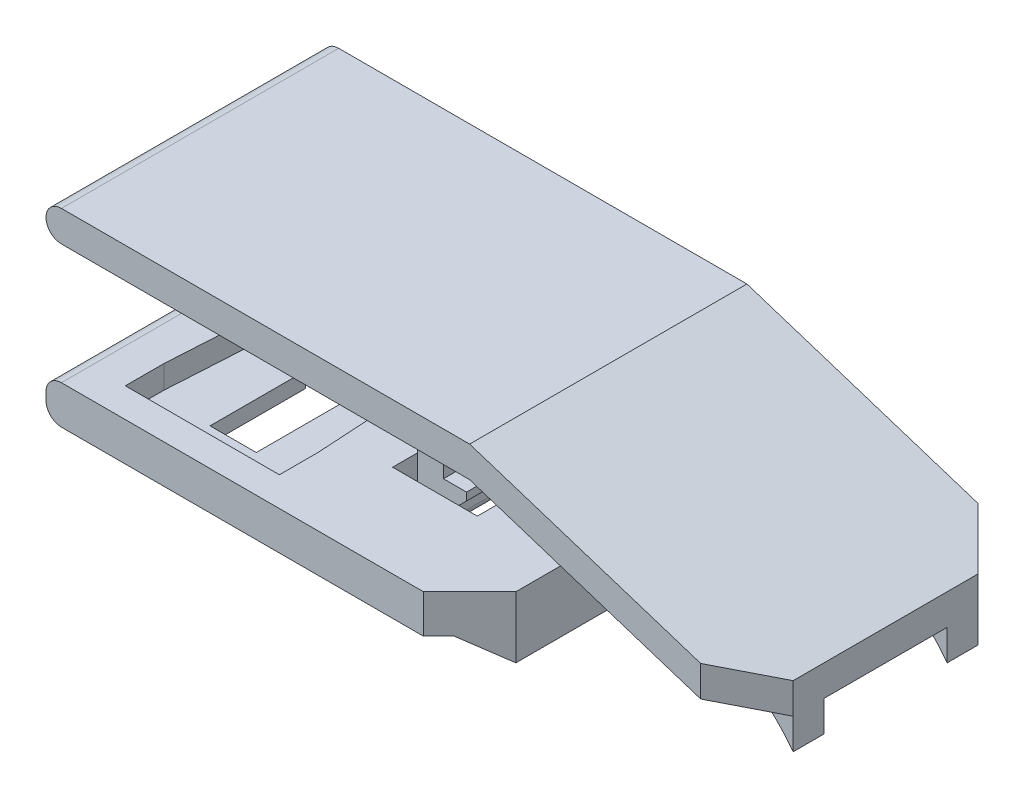
from build123d import *

# Parameters (mm, degrees)
BOSS_EXTRUDE1_DEPTH     = 18
BOSS_EXTRUDE1_2_DEPTH   = 18
SKETCH2_W               = 5.5
SKETCH2_H               = 6
CUT_EXTRUDE1_DEPTH      = 3
BOSS_EXTRUDE2_DEPTH     = 6
BOSS_EXTRUDE3_START     = -9
BOSS_EXTRUDE3_DEPTH     = 2.5
FILLET7_R               = 1
FILLET8_R               = 1
FILLET10_R              = 1
FILLET11_R              = 1
BOSS_EXTRUDE4_START     = -3
BOSS_EXTRUDE4_DEPTH     = 2
BOSS_EXTRUDE5_START     = -13
BOSS_EXTRUDE5_DEPTH     = 2
FILLET12_R              = 0.5
FILLET13_R              = 0.5
CUT_EXTRUDE2_DEPTH      = 1.5
CUT_EXTRUDE2_DEPTH_BACK = 9
CUT_EXTRUDE3_DEPTH      = 51.839846577
CUT_EXTRUDE9_DEPTH      = 51.453344785
CUT_EXTRUDE9_DEPTH_BACK = 2.5
CUT_EXTRUDE10_DEPTH     = 1
BOSS_EXTRUDE8_START     = 7
BOSS_EXTRUDE8_DEPTH     = 4


with BuildPart() as part:
    # Sketch1 → Boss-Extrude1 (new body)
    with BuildSketch(Plane.XY):
        Polygon((0, 4), (-18, 9.8), (-45.5, 9.8), (-45.5, 7.8), (-18, 7.8), (0, 2), align=None)
    extrude(amount=BOSS_EXTRUDE1_DEPTH)

    # Sketch4 → Boss-Extrude3 (add, symmetric)
    with BuildSketch(Plane.XY.offset(18).offset(BOSS_EXTRUDE3_START)):
        with BuildLine():
            Line((-26.7, -2), (-24.7, 0))
            Line((-24.7, 0), (-24.7, 0.5))
            Line((-24.7, 0.5), (-26.2, 0.5))
            Line((-26.2, 0.5), (-26.2, 1.5))
            Line((-26.2, 1.5), (-19.9, 7.8))
            Line((-19.9, 7.8), (-22.304163056, 7.8))
            Line((-22.304163056, 7.8), (-27.402081528, 2.702081528))
            ThreePointArc((-27.402081528, 2.702081528), (-27.770595205, 2.150561835), (-27.9, 1.5))
            Line((-27.9, 1.5), (-27.9, -3))
            Line((-27.9, -3), (-26.7, -3))
            Line((-26.7, -3), (-26.7, -2))
        make_face()
    extrude(amount=BOSS_EXTRUDE3_DEPTH, both=True)

    # Fillet8
    fillet8_edges = [part.edges().sort_by_distance(p)[0] for p in [
        (-45.5, 7.8, 9),
    ]]
    fillet(fillet8_edges, radius=FILLET8_R)

    # Fillet10
    fillet10_edges = [part.edges().sort_by_distance(p)[0] for p in [
        (-45.5, 9.8, 9),
    ]]
    fillet(fillet10_edges, radius=FILLET10_R - 0.0001)  # a hair under: the kernel refuses the full size

    # Sketch5 → Boss-Extrude4 (add)
    with BuildSketch(Plane.XY.offset(18).offset(BOSS_EXTRUDE4_START)):
        with BuildLine():
            Line((0, 2), (0, 0))
            ThreePointArc((0, 0), (-2.215757041, 2.201466243), (-5.002612018, 3.611952761))
            Line((-5.002612018, 3.611952761), (0, 2))
        make_face()
    extrude(amount=-BOSS_EXTRUDE4_DEPTH)

    # Sketch5<2> → Boss-Extrude5 (add)
    with BuildSketch(Plane.XY.offset(18).offset(BOSS_EXTRUDE5_START)):
        with BuildLine():
            Line((0, 2), (0, 0))
            ThreePointArc((0, 0), (-2.215757041, 2.201466243), (-5.002612018, 3.611952761))
            Line((-5.002612018, 3.611952761), (0, 2))
        make_face()
    extrude(amount=-BOSS_EXTRUDE5_DEPTH)

    # Fillet12
    fillet12_edges = [part.edges().sort_by_distance(p)[0] for p in [
        (-26.7, -3, 9),
        (-27.9, -3, 9),
    ]]
    fillet(fillet12_edges, radius=FILLET12_R)

    # Fillet13
    fillet13_edges = [part.edges().sort_by_distance(p)[0] for p in [
        (-26.2, 1.5, 9),
    ]]
    fillet(fillet13_edges, radius=FILLET13_R)


with BuildPart() as body_2:
    # Sketch1 → Boss-Extrude1 2 (new body)
    with BuildSketch(Plane.XY):
        Polygon((-18, 0), (-45.5, 0), (-45.5, -2.5), (-20, -2.5), (-18, -4), align=None)
    extrude(amount=BOSS_EXTRUDE1_2_DEPTH)

    # Sketch2 → Cut-Extrude1 (cut)
    with BuildSketch(Plane.XZ.offset(2.5)):
        with Locations((-26.25, 9)):
            Rectangle(SKETCH2_W, SKETCH2_H)
    extrude(amount=-CUT_EXTRUDE1_DEPTH, mode=Mode.SUBTRACT)

    # Sketch3 → Boss-Extrude2 (add)
    with BuildSketch(Plane.XY.offset(6)):
        Polygon((-23.5, 0), (-25.5, -2), (-25.5, -2.5), (-23.5, -2.5), align=None)
    extrude(amount=BOSS_EXTRUDE2_DEPTH)

    # Fillet7
    fillet7_edges = [body_2.edges().sort_by_distance(p)[0] for p in [
        (-45.5, 0, 9),
    ]]
    fillet(fillet7_edges, radius=FILLET7_R)

    # Fillet11
    fillet11_edges = [body_2.edges().sort_by_distance(p)[0] for p in [
        (-45.5, -2.5, 9),
    ]]
    fillet(fillet11_edges, radius=FILLET11_R)


with BuildPart() as cut_extrude2_tool:
    # Sketch6 → Cut-Extrude2 (new, two sides: drawn at the far end of the back side and taken through both)
    with BuildSketch(Plane.XZ.offset(-CUT_EXTRUDE2_DEPTH_BACK)):
        Polygon((-32.8, 1.9), (-41.7, 1.9), (-41.7, 4.395495943), (-42.25, 13.604504057), (-42.25, 16.1), (-32.25, 16.1), (-32.25, 13.604504057), (-32.8, 4.395495943), align=None)
    extrude(amount=CUT_EXTRUDE2_DEPTH + CUT_EXTRUDE2_DEPTH_BACK)


with BuildPart() as part_1:
    add(part.part)

    # Cut-Extrude2: cut by cut_extrude2_tool
    add(cut_extrude2_tool.part, mode=Mode.SUBTRACT)

    # Sketch7 → Cut-Extrude3 (cut, through all)
    with BuildSketch(Plane(origin=(0, 9.8, 0), x_dir=(1, 0, 0), z_dir=(0, 1, 0))):
        Polygon((0, -3), (-3, 0), (-45.5, 0), (-45.5, -18), (-3, -18), (0, -15), (2, -15), (2, -20), (-48, -20), (-48, 2), (2, 2), (2, -3), align=None)
    extrude(amount=-CUT_EXTRUDE3_DEPTH, mode=Mode.SUBTRACT)


with BuildPart() as body_2_1:
    add(body_2.part)

    # Cut-Extrude2: cut by cut_extrude2_tool
    add(cut_extrude2_tool.part, mode=Mode.SUBTRACT)

    # Sketch8 → Cut-Extrude9 (cut, two sides: drawn at the far end of the back side and taken through both)
    with BuildSketch(Plane.XZ.offset(2.5).offset(-CUT_EXTRUDE9_DEPTH_BACK)):
        Polygon((-18, 15), (-16, 15), (-16, 20), (-47.5, 20), (-47.5, -2), (-16, -2), (-16, 3), (-18, 3), (-21, 0), (-45.5, 0), (-45.5, 18), (-21, 18), align=None)
    extrude(amount=CUT_EXTRUDE9_DEPTH + CUT_EXTRUDE9_DEPTH_BACK, mode=Mode.SUBTRACT)

    # Sketch9 → Cut-Extrude10 (cut)
    with BuildSketch(Plane.XZ.offset(1.5)):
        Polygon((-38.75, 14.1), (-35.75, 14.1), (-35.75, 7.9), (-33.25, 7.9), (-37.25, 3.9), (-41.25, 7.9), (-38.75, 7.9), align=None)
    extrude(amount=CUT_EXTRUDE10_DEPTH, mode=Mode.SUBTRACT)


with BuildPart() as body_3:
    # Sketch11 → Boss-Extrude8 (new body)
    with BuildSketch(Plane.XY.offset(BOSS_EXTRUDE8_START)):
        with BuildLine():
            Line((-16, 0), (-9, 0))
            ThreePointArc((-9, 0), (-12.5, 3.5), (-16, 0))
        make_face()
    extrude(amount=BOSS_EXTRUDE8_DEPTH)


solid = Compound([part_1.part, body_2_1.part, body_3.part])
